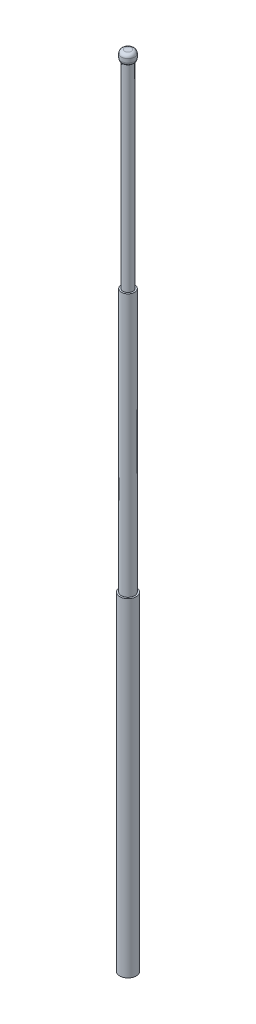
from build123d import *

# Parameters (mm, degrees)
SKETCH1_R           = 6.35
BOSS_EXTRUDE1_DEPTH = 254
SKETCH2_R           = 5.08
BOSS_EXTRUDE2_DEPTH = 203.2
SKETCH3_R           = 3.81
BOSS_EXTRUDE3_DEPTH = 152.4
SKETCH4_R           = 5.08
BOSS_EXTRUDE4_DEPTH = 7.62
FILLET1_R           = 2.54


with BuildPart() as part:
    # Sketch1 → Boss-Extrude1 (new body)
    with BuildSketch(Plane(origin=(0, 0, 0), x_dir=(1, 0, 0), z_dir=(0, 1, 0))):
        with Locations(Location((0, 0, 0), (0, 0, 270))):
            Circle(SKETCH1_R)
    extrude(amount=BOSS_EXTRUDE1_DEPTH)

    # Sketch2 → Boss-Extrude2 (add)
    with BuildSketch(Plane(origin=(0, 254, 0), x_dir=(1, 0, 0), z_dir=(0, 1, 0))):
        with Locations(Location((0, 0, 0), (0, 0, 270))):
            Circle(SKETCH2_R)
    extrude(amount=BOSS_EXTRUDE2_DEPTH)

    # Sketch3 → Boss-Extrude3 (add)
    with BuildSketch(Plane(origin=(0, 457.2, 0), x_dir=(1, 0, 0), z_dir=(0, 1, 0))):
        with Locations(Location((0, 0, 0), (0, 0, 90))):
            Circle(SKETCH3_R)
    extrude(amount=BOSS_EXTRUDE3_DEPTH)

    # Sketch4 → Boss-Extrude4 (add)
    with BuildSketch(Plane(origin=(0, 609.6, 0), x_dir=(1, 0, 0), z_dir=(0, 1, 0))):
        with Locations(Location((0, 0, 0), (0, 0, 270))):
            Circle(SKETCH4_R)
    extrude(amount=BOSS_EXTRUDE4_DEPTH)

    # Fillet1
    # the kernel refuses this fillet: 2.54 mm, written as the material it takes off along each edge
    with BuildSketch(Plane(origin=(0, 609.6, 0), x_dir=(0, 0, 1), z_dir=(-1, 0, 0))) as fillet1_piece_1:
        with BuildLine():
            CenterArc((2.54, 2.199704526), FILLET1_R, 300, 60)
            Line((3.81, 0), (3.8354, -0.043994091))
            ThreePointArc((3.8354, -0.043994091), (4.445, -0.0508), (5.08, -0.0508))
            Line((5.08, -0.0508), (5.1308, 0))
            Line((5.1308, 0), (5.1308, 2.199704526))
            Line((5.1308, 2.199704526), (5.08, 2.199704526))
        make_face()
    revolve(axis=Axis((0, 609.6, 0), (0, 1, 0)), mode=Mode.SUBTRACT)
    with BuildSketch(Plane(origin=(0, 617.22, 0), x_dir=(0, 0, 1), z_dir=(-1, 0, 0))) as fillet1_piece_2:
        with BuildLine():
            CenterArc((5.08 - FILLET1_R, -FILLET1_R), FILLET1_R, 0, 90)
            Line((5.08 - FILLET1_R, 0), (5.08 - FILLET1_R, FILLET1_R * 0.02))
            Line((5.08 - FILLET1_R, FILLET1_R * 0.02), (5.08 + FILLET1_R * 0.02, FILLET1_R * 0.02))
            Line((5.08 + FILLET1_R * 0.02, FILLET1_R * 0.02), (5.08 + FILLET1_R * 0.02, -FILLET1_R))
            Line((5.08 + FILLET1_R * 0.02, -FILLET1_R), (5.08, -FILLET1_R))
        make_face()
    revolve(axis=Axis((0, 617.22, 0), (0, 1, 0)), mode=Mode.SUBTRACT)


solid = part.part
